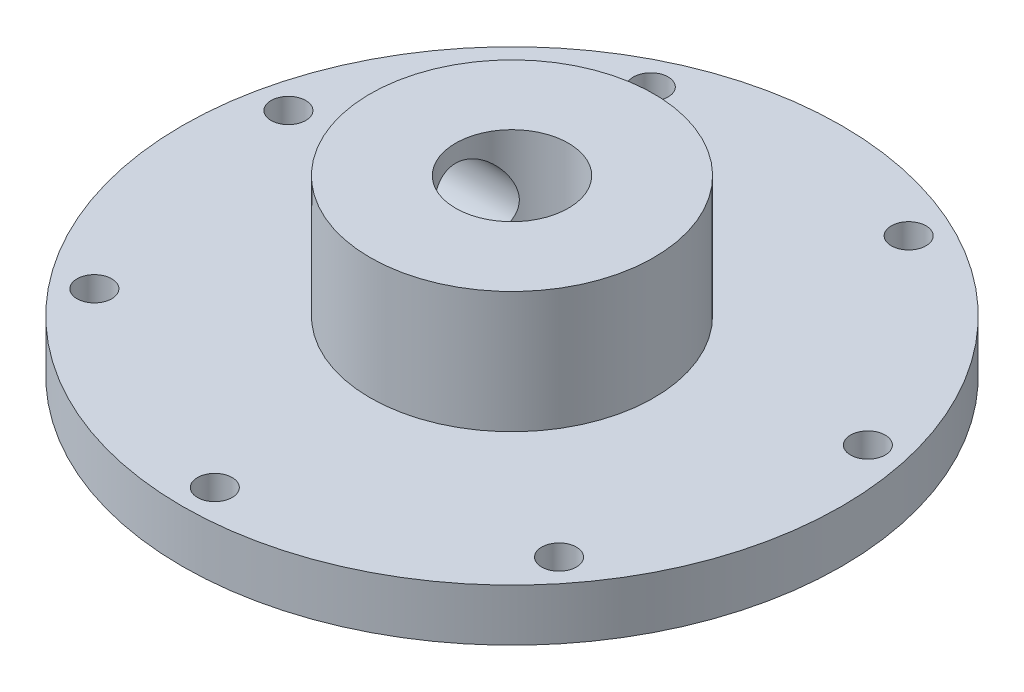
from build123d import *

# Parameters (mm, degrees)
BOSS_EXTRUDE1_DEPTH      = 7
BOSS_EXTRUDE1_DEPTH_BACK = 3
SKETCH1_R                = 8.175
SKETCH1_R_2              = 3.25
SKETCH1_3_R              = 19
SKETCH1_3_R_2            = 8.175
BOSS_EXTRUDE2_DEPTH      = 3
SKETCH2_R                = 2.5
CUT_EXTRUDE1_DEPTH       = 15
CUT_EXTRUDE2_DEPTH       = 3.175
CUT_EXTRUDE2_DEPTH_BACK  = 29.670542409
SKETCH3_R                = 1
SKETCH4_R                = 4.175
BOSS_EXTRUDE4_DEPTH      = 5
CUT_EXTRUDE3_DEPTH       = 15
CUT_EXTRUDE3_DEPTH_BACK  = 13
SKETCH1_5_R              = 3.25


with BuildPart() as part:
    # Sketch1 → Boss-Extrude1 (new, two sides: drawn at the far end of the back side and taken through both)
    with BuildSketch(Plane(origin=(0, 0, 0), x_dir=(1, 0, 0), z_dir=(0, 1, 0)).offset(-BOSS_EXTRUDE1_DEPTH_BACK)):
        Circle(SKETCH1_R)
        Circle(SKETCH1_R_2, mode=Mode.SUBTRACT)
    extrude(amount=BOSS_EXTRUDE1_DEPTH + BOSS_EXTRUDE1_DEPTH_BACK)

    # Sketch2 → Cut-Extrude1 (cut)
    with BuildSketch(Plane(origin=(0, 0, 0), x_dir=(0, 0, -1), z_dir=(1, 0, 0))):
        with Locations((0, 3.5)):
            Circle(SKETCH2_R)
    extrude(amount=-CUT_EXTRUDE1_DEPTH, mode=Mode.SUBTRACT)



with BuildPart() as body_2:
    # Sketch1<3> → Boss-Extrude2 (new body)
    with BuildSketch(Plane(origin=(0, 0, 0), x_dir=(1, 0, 0), z_dir=(0, 1, 0))):
        Circle(SKETCH1_3_R)
        Circle(SKETCH1_3_R_2, mode=Mode.SUBTRACT)
    extrude(amount=-BOSS_EXTRUDE2_DEPTH)

    # Sketch3 → Cut-Extrude2 (cut, two sides: drawn at the far end of the back side and taken through both)
    with BuildSketch(Plane.XZ.offset(3).offset(-CUT_EXTRUDE2_DEPTH_BACK)):
        with Locations((0, 17.125481179)):
            Circle(SKETCH3_R)
        with Locations((13.389240338, 10.677562867)):
            Circle(SKETCH3_R)
        with Locations((16.696109611, -3.810778066)):
            Circle(SKETCH3_R)
        with Locations((7.430467808, -15.42952539)):
            Circle(SKETCH3_R)
        with Locations((-7.430467808, -15.42952539)):
            Circle(SKETCH3_R)
        with Locations((-16.696109611, -3.810778066)):
            Circle(SKETCH3_R)
        with Locations((-13.389240338, 10.677562867)):
            Circle(SKETCH3_R)
    extrude(amount=CUT_EXTRUDE2_DEPTH + CUT_EXTRUDE2_DEPTH_BACK, mode=Mode.SUBTRACT)


with BuildPart() as part_1:
    add(part.part)

    add(body_2.part)  # Boss-Extrude4 merges body 2
    # Sketch4 → Boss-Extrude4 (add)
    with BuildSketch(Plane.XZ.offset(3)):
        Circle(SKETCH4_R)
    extrude(amount=BOSS_EXTRUDE4_DEPTH)

    # Sketch1<5> → Cut-Extrude3 (cut, two sides: drawn at the far end of the back side and taken through both)
    with BuildSketch(Plane(origin=(0, 0, 0), x_dir=(1, 0, 0), z_dir=(0, 1, 0)).offset(-CUT_EXTRUDE3_DEPTH_BACK)):
        Circle(SKETCH1_5_R)
    extrude(amount=CUT_EXTRUDE3_DEPTH + CUT_EXTRUDE3_DEPTH_BACK, mode=Mode.SUBTRACT)


solid = part_1.part
